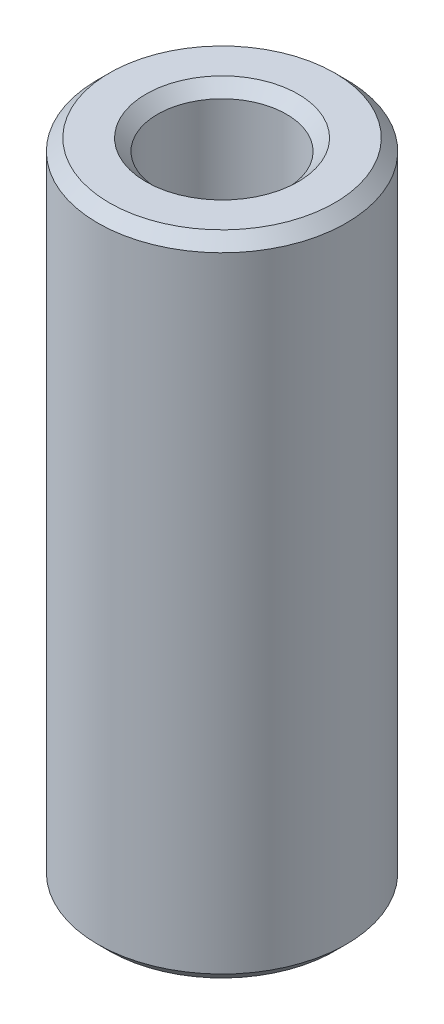
from build123d import *

# Parameters (mm, degrees)
SKETCH1_R           = 42.5
BOSS_EXTRUDE1_DEPTH = 221.633096256
SKETCH2_R           = 22.034078557
CUT_EXTRUDE1_DEPTH  = 230.638257606
CHAMFER1_SIZE       = 3.980405153


with BuildPart() as part:
    # Sketch1 → Boss-Extrude1 (new body)
    with BuildSketch(Plane(origin=(0, 0, 0), x_dir=(1, 0, 0), z_dir=(0, 1, 0))):
        Circle(SKETCH1_R)
    extrude(amount=BOSS_EXTRUDE1_DEPTH)

    # Sketch2 → Cut-Extrude1 (cut, through all)
    with BuildSketch(Plane(origin=(0, 0, 0), x_dir=(1, 0, 0), z_dir=(0, 1, 0))):
        Circle(SKETCH2_R)
    extrude(amount=CUT_EXTRUDE1_DEPTH, mode=Mode.SUBTRACT)

    # Chamfer1
    chamfer1_edges = [part.edges().sort_by_distance(p)[0] for p in [
        (-22.034078557, 221.633096256, 0),
        (-22.034078557, 0, 0),
        (-42.5, 0, 0),
        (-42.5, 221.633096256, 0),
    ]]
    chamfer(chamfer1_edges, length=CHAMFER1_SIZE)


solid = part.part
